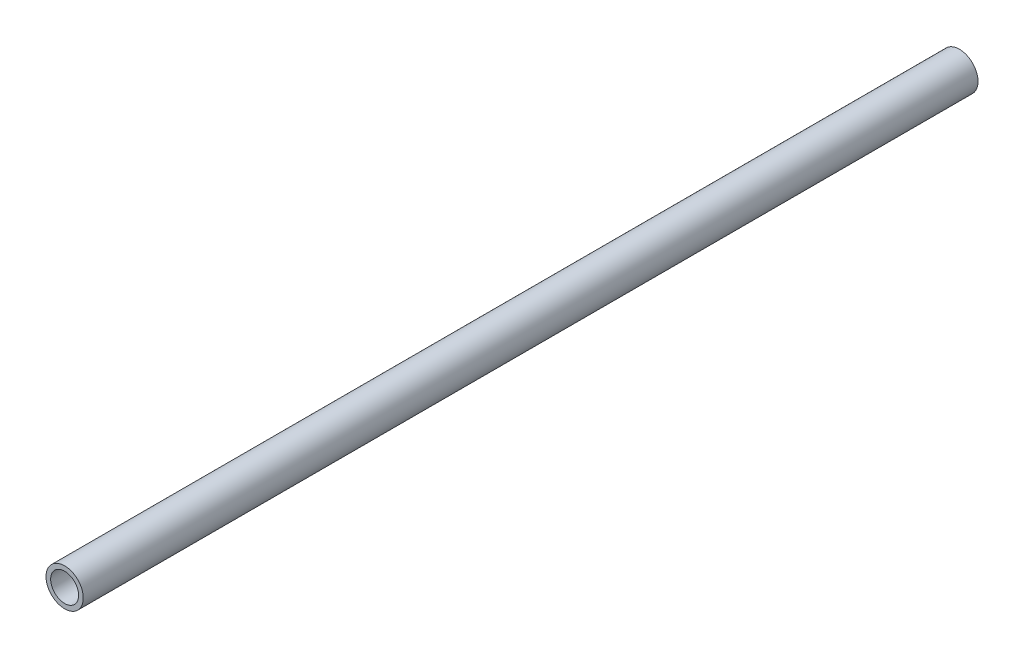
from build123d import *

# Parameters (mm, degrees)
SKETCH2_R           = 12.7
SKETCH2_R_2         = 9.525
BOSS_EXTRUDE1_DEPTH = 304.8


with BuildPart() as part:
    # Sketch2 → Boss-Extrude1 (new, symmetric)
    with BuildSketch(Plane.XY):
        Circle(SKETCH2_R)
        Circle(SKETCH2_R_2, mode=Mode.SUBTRACT)
    extrude(amount=BOSS_EXTRUDE1_DEPTH, both=True)


solid = part.part
